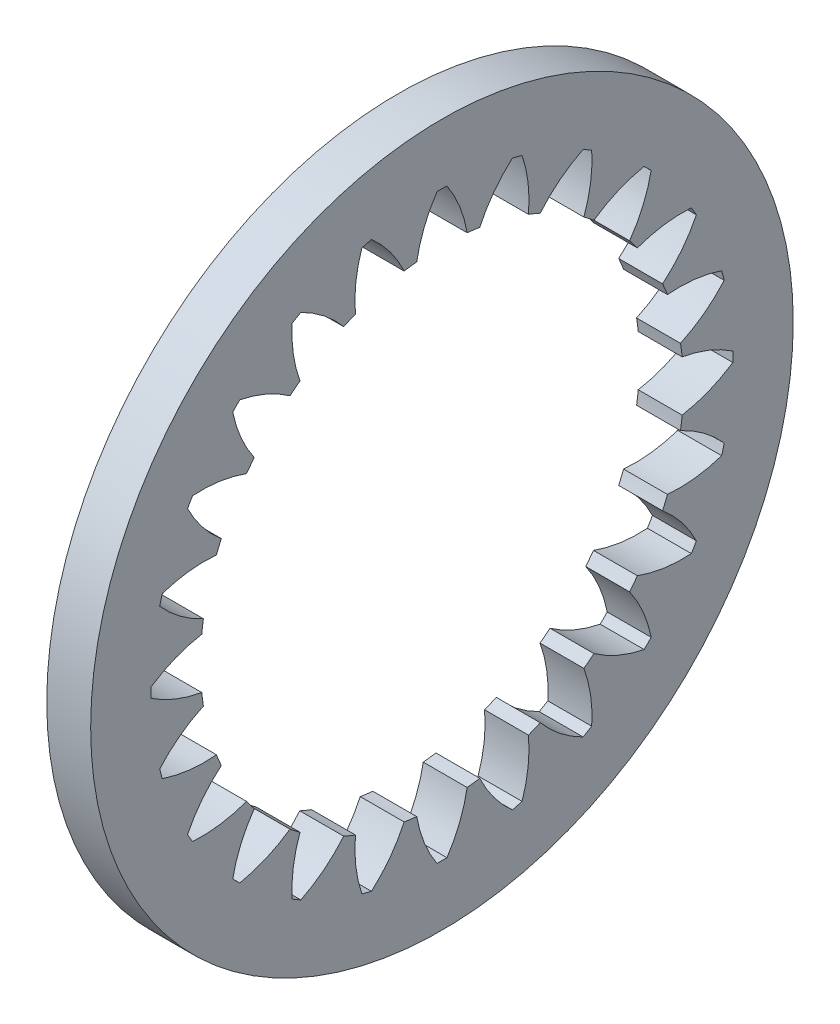
from build123d import *

# Parameters (mm, degrees)
BASPROSKE_W     = 12.7
BASPROSKE_H     = 31.75
TOOTHCUT_DEPTH  = 145.244271983
TEETHCUTS_COUNT = 24
TEETHCUTS_ANGLE = 345


with BuildPart() as part:
    # BasProSke → Base-Revolve (revolve)
    with BuildSketch(Plane(origin=(0, 0, 0), x_dir=(1, 0, 0), z_dir=(0, 1, 0))):
        with Locations((6.35, 85.725)):
            Rectangle(BASPROSKE_W, BASPROSKE_H)
    revolve(axis=Axis((-10, 0, 0), (1, 0, 0)))

    # TooCutSke → ToothCut (cut, through all)
    with BuildSketch(Plane(origin=(0, 0, 0), x_dir=(0, 0, -1), z_dir=(1, 0, 0))):
        with BuildLine():
            ThreePointArc((7.294804836, 69.442498425), (5.138539952, 77.091294309), (1.442489481, 84.126403948))
            ThreePointArc((1.442489481, 84.126403948), (0, 84.13877), (-1.442489481, 84.126403948))
            ThreePointArc((-1.442489481, 84.126403948), (-5.138539952, 77.091294309), (-7.294804836, 69.442498425))
            ThreePointArc((-7.294804836, 69.442498425), (0, 69.8246), (7.294804836, 69.442498425))
        make_face()
    toothcut = extrude(amount=TOOTHCUT_DEPTH, mode=Mode.SUBTRACT)

    # TeethCuts: ToothCut ×24 about axis
    teethcuts_axis = Axis((-10, 0, 0), (1, 0, 0))
    for i in range(1, TEETHCUTS_COUNT):
        add(toothcut.rotate(teethcuts_axis, i * TEETHCUTS_ANGLE / (TEETHCUTS_COUNT - 1)), mode=Mode.SUBTRACT)


solid = part.part
